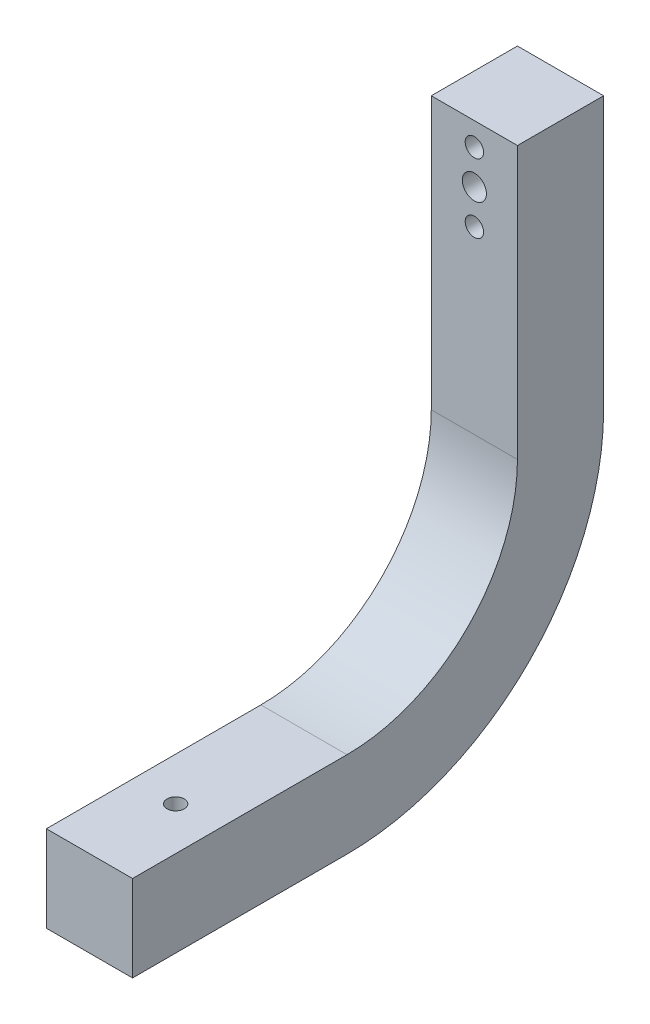
from build123d import *

# Parameters (mm, degrees)
BOSS_EXTRUDE1_DEPTH      = 7.5
BOSS_EXTRUDE1_DEPTH_BACK = 7.5
SKETCH3_R                = 1.5
CUT_EXTRUDE1_DEPTH       = 113.735309464
CUT_EXTRUDE2_DEPTH       = 107.156723763
CUT_EXTRUDE2_DEPTH_BACK  = 107.156723763
SKETCH4_R                = 2.1
SKETCH4_R_2              = 1.6
SKETCH5_R                = 2.275
CUT_EXTRUDE3_DEPTH       = 6
SKETCH6_R                = 3.825
CUT_EXTRUDE4_DEPTH       = 0.75


with BuildPart() as part:
    # Sketch1 → Boss-Extrude1 (new, two sides: drawn at the far end of the back side and taken through both)
    with BuildSketch(Plane(origin=(0, 0, 0), x_dir=(0, 0, -1), z_dir=(1, 0, 0)).offset(-BOSS_EXTRUDE1_DEPTH_BACK)):
        with BuildLine():
            Line((-15, 10), (0, 10))
            Line((0, 10), (0, -37.333333333))
            ThreePointArc((0, -37.333333333), (-13.082563774, -68.917436226), (-44.666666667, -82))
            Line((-44.666666667, -82), (-67, -82))
            Line((-67, -82), (-82, -82))
            Line((-82, -82), (-82, -67))
            Line((-82, -67), (-67, -67))
            Line((-67, -67), (-44.666666667, -67))
            ThreePointArc((-44.666666667, -67), (-23.689165491, -58.310834509), (-15, -37.333333333))
            Line((-15, -37.333333333), (-15, 10))
        make_face()
    extrude(amount=BOSS_EXTRUDE1_DEPTH + BOSS_EXTRUDE1_DEPTH_BACK)

    # Sketch3 → Cut-Extrude1 (cut, through all)
    with BuildSketch(Plane(origin=(0, -67, 0), x_dir=(1, 0, 0), z_dir=(0, 1, 0))):
        with Locations((0, -67)):
            Circle(SKETCH3_R)
    extrude(amount=-CUT_EXTRUDE1_DEPTH, mode=Mode.SUBTRACT)

    # Sketch4 → Cut-Extrude2 (cut, two sides: drawn at the far end of the back side and taken through both)
    with BuildSketch(Plane.XY.offset(15).offset(-CUT_EXTRUDE2_DEPTH_BACK)):
        Circle(SKETCH4_R)
        with Locations((0, 6)):
            Circle(SKETCH4_R_2)
        with Locations((0, -6)):
            Circle(SKETCH4_R_2)
    extrude(amount=CUT_EXTRUDE2_DEPTH + CUT_EXTRUDE2_DEPTH_BACK, mode=Mode.SUBTRACT)

    # Sketch5 → Cut-Extrude3 (cut)
    with BuildSketch(Plane.XZ.offset(82)):
        with Locations((0, 67)):
            Circle(SKETCH5_R)
    extrude(amount=-CUT_EXTRUDE3_DEPTH, mode=Mode.SUBTRACT)

    # Sketch6 → Cut-Extrude4 (cut)
    with BuildSketch(Plane.XZ.offset(82)):
        with Locations((0, 67)):
            Circle(SKETCH6_R)
    extrude(amount=-CUT_EXTRUDE4_DEPTH, mode=Mode.SUBTRACT)


solid = part.part
